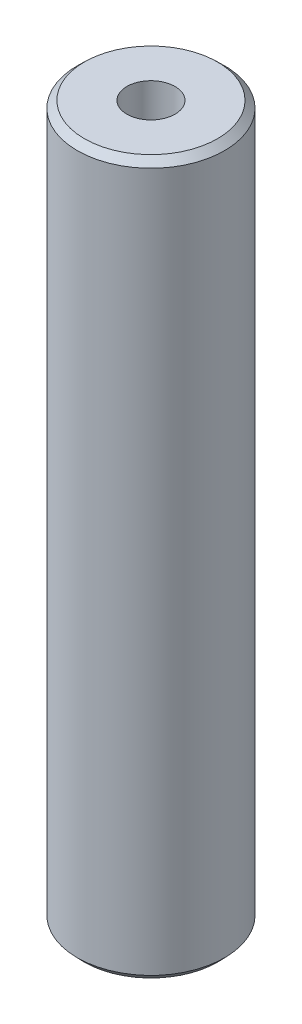
from build123d import *
from OCP.BRepFilletAPI import BRepFilletAPI_MakeChamfer

# Parameters (mm, degrees)
SKETCH1_R           = 25
BOSS_EXTRUDE1_DEPTH = 242.061241206
SKETCH2_R           = 8.175286403
CUT_EXTRUDE1_DEPTH  = 245.62960674
CHAMFER1_SIZE       = 2.30895655
CHAMFER1_SIZE2      = 2.403734853


with BuildPart() as part:
    # Sketch1 → Boss-Extrude1 (new body)
    with BuildSketch(Plane(origin=(0, 0, 0), x_dir=(1, 0, 0), z_dir=(0, 1, 0))):
        Circle(SKETCH1_R)
    extrude(amount=BOSS_EXTRUDE1_DEPTH)

    # Sketch2 → Cut-Extrude1 (cut, through all)
    with BuildSketch(Plane(origin=(0, 0, 0), x_dir=(1, 0, 0), z_dir=(0, 1, 0))):
        Circle(SKETCH2_R)
    extrude(amount=CUT_EXTRUDE1_DEPTH, mode=Mode.SUBTRACT)

    # Chamfer1: one chamfer whose edges measure the first distance from different faces: ONE call of the kernel's chamfer builder (chamfer() names one face for all edges)
    chamfer1_edges_1 = [part.edges().sort_by_distance(p)[0] for p in [
        (-25, 242.061241206, 0),
    ]]
    chamfer1_side_1 = [part.faces().sort_by_distance(p)[0] for p in [
        (-25, 121.030620603, 0),
    ]]
    chamfer1_edges_2 = [part.edges().sort_by_distance(p)[0] for p in [
        (-25, 0, 0),
    ]]
    chamfer1_side_2 = [part.faces().sort_by_distance(p)[0] for p in [
        (-24.292893219, 0, 0),
    ]]
    chamfer1 = BRepFilletAPI_MakeChamfer(part.part.solid().wrapped)
    for e in chamfer1_edges_1:
        chamfer1.Add(CHAMFER1_SIZE, CHAMFER1_SIZE2, e.wrapped, chamfer1_side_1[0].wrapped)  # the first distance lies on this face
    for e in chamfer1_edges_2:
        chamfer1.Add(CHAMFER1_SIZE, CHAMFER1_SIZE2, e.wrapped, chamfer1_side_2[0].wrapped)  # the first distance lies on this face
    add(Compound.cast(chamfer1.Shape()), mode=Mode.REPLACE)


solid = part.part
